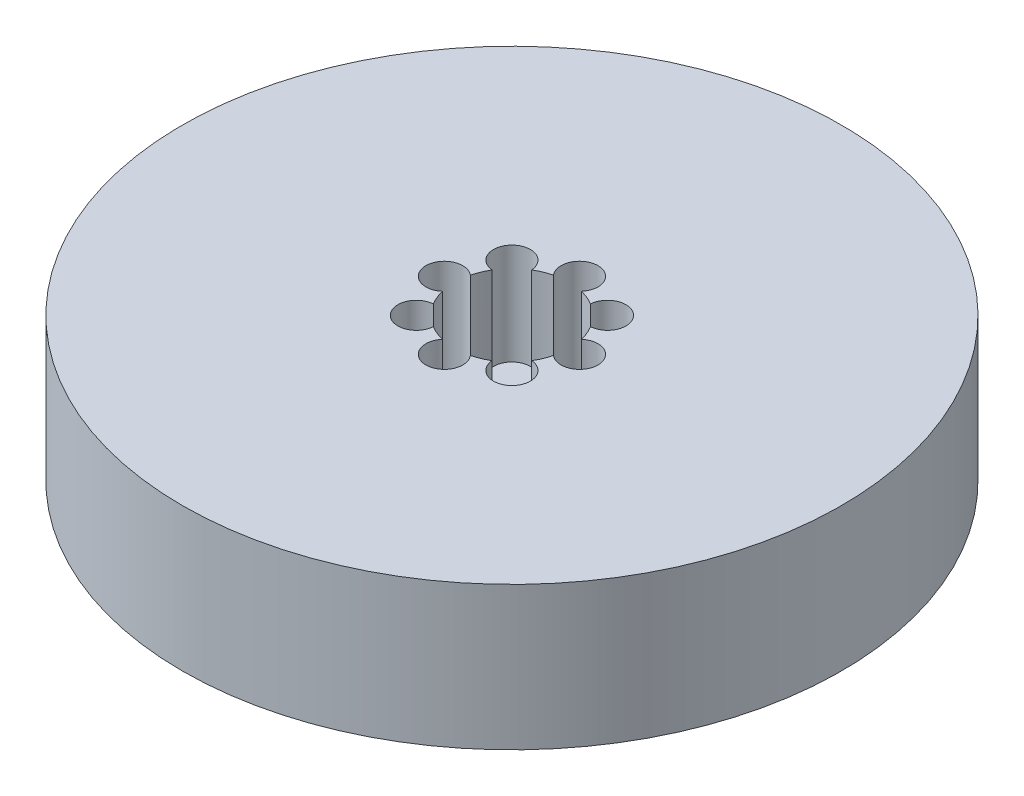
from build123d import *

# Parameters (mm, degrees)
SKETCH1_R           = 57.5
BOSS_EXTRUDE1_DEPTH = 25
SKETCH2_R           = 10
CUT_EXTRUDE1_DEPTH  = 86.073497636
SKETCH3_R           = 3.219002266
CUT_EXTRUDE2_DEPTH  = 17.669629676
CIRPATTERN1_COUNT   = 8


with BuildPart() as part:
    # Sketch1 → Boss-Extrude1 (new body)
    with BuildSketch(Plane(origin=(0, 0, 0), x_dir=(1, 0, 0), z_dir=(0, 1, 0))):
        Circle(SKETCH1_R)
    extrude(amount=BOSS_EXTRUDE1_DEPTH)

    # Sketch2 → Cut-Extrude1 (cut, through all)
    with BuildSketch(Plane(origin=(0, 0, 0), x_dir=(1, 0, 0), z_dir=(0, 1, 0))):
        Circle(SKETCH2_R)
    extrude(amount=CUT_EXTRUDE1_DEPTH, mode=Mode.SUBTRACT)

    # Sketch3 → Cut-Extrude2 (cut)
    with BuildSketch(Plane(origin=(0, 25, 0), x_dir=(1, 0, 0), z_dir=(0, 1, 0))):
        with Locations((-11.793512299, 0)):
            Circle(SKETCH3_R)
    cut_extrude2 = extrude(amount=-CUT_EXTRUDE2_DEPTH, mode=Mode.SUBTRACT)

    # CirPattern1: Cut-Extrude2 ×8 about axis
    cirpattern1_axis = Axis((0, 0, 0), (0, 1, 0))
    for i in range(1, CIRPATTERN1_COUNT):
        add(cut_extrude2.rotate(cirpattern1_axis, i * 360 / CIRPATTERN1_COUNT), mode=Mode.SUBTRACT)


solid = part.part
